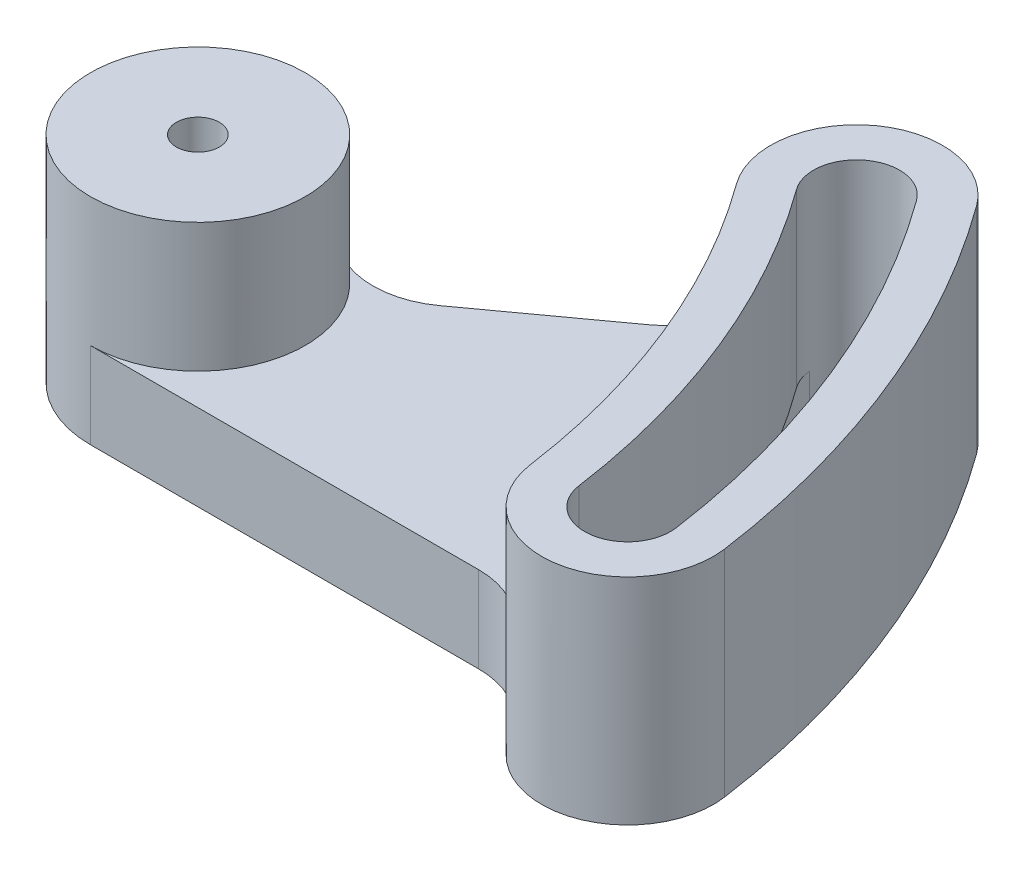
from build123d import *

# Parameters (mm, degrees)
SKETCH1_R                = 25
SKETCH1_R_2              = 5
BOSS_EXTRUDE1_DEPTH      = 50
BOSS_EXTRUDE4_DEPTH      = 20
BOSS_EXTRUDE5_DEPTH      = 30
BOSS_EXTRUDE5_DEPTH_BACK = 20
FILLET2_R                = 20
SHELL2_DEPTH             = 40
SHELL2_2_DEPTH           = 10
CUT_EXTRUDE2_DEPTH       = 171.486818667
CUT_EXTRUDE2_DEPTH_BACK  = 171.486818667


# Read off the part's stored shape, not the designer's step: Shell2
with BuildPart() as part:
    # Sketch1 → Boss-Extrude1 (new body)
    with BuildSketch(Plane(origin=(0, 0, 0), x_dir=(1, 0, 0), z_dir=(0, 1, 0))):
        with Locations(Location((0, 0, 0), (0, 0, 270))):
            Circle(SKETCH1_R)
        with Locations(Location((0, 0, 0), (0, 0, 270))):
            Circle(SKETCH1_R_2, mode=Mode.SUBTRACT)
    extrude(amount=BOSS_EXTRUDE1_DEPTH)

    # Sketch3 → Boss-Extrude4 (add)
    with BuildSketch(Plane(origin=(0, 0, 0), x_dir=(1, 0, 0), z_dir=(0, 1, 0))):
        with BuildLine():
            Line((0, -25), (125, -25))
            ThreePointArc((125, -25), (112.372583962, 21.969985307), (88.780749417, 64.502990119))
            Line((88.780749417, 64.502990119), (20.225424859, 14.694631307))
            ThreePointArc((20.225424859, 14.694631307), (23.776412907, 7.725424859), (25, 0))
            ThreePointArc((25, 0), (17.67766953, -17.67766953), (0, -25))
        make_face()
    extrude(amount=BOSS_EXTRUDE4_DEPTH)

    # Sketch4 → Boss-Extrude5 (add, two sides: drawn at the far end of the back side and taken through both)
    with BuildSketch(Plane(origin=(0, 20, 0), x_dir=(1, 0, 0), z_dir=(0, 1, 0)).offset(-BOSS_EXTRUDE5_DEPTH_BACK)):
        with BuildLine():
            ThreePointArc((144.802264946, -22.194593966), (130.912107304, 29.472389872), (104.961089304, 76.258695165))
            ThreePointArc((104.961089304, 76.258695165), (77.025044371, 80.683330007), (72.600409529, 52.747285074))
            ThreePointArc((72.600409529, 52.747285074), (93.83306062, 14.467580743), (105.197735054, -27.805406034))
            ThreePointArc((105.197735054, -27.805406034), (127.805406034, -44.802264946), (144.802264946, -22.194593966))
        make_face()
    extrude(amount=BOSS_EXTRUDE5_DEPTH + BOSS_EXTRUDE5_DEPTH_BACK)

    # Fillet2
    # the kernel refuses this fillet: 20 mm, written as the material it adds along each edge
    with BuildSketch(Plane(origin=(20.225424859, 0, -14.694631307), x_dir=(-0.7569254846609251, 0, -0.6535011940852316), z_dir=(0, 1, 0))) as fillet2_piece_1:
        with BuildLine():
            CenterArc((15.977305143, -19.472064177), FILLET2_R, 103.193899981, 63.612200039)
            Line((-3.494759034, -14.90711985), (0, 0))
            ThreePointArc((0, 0), (5.706180408, -0.659919779), (11.412360816, 0))
        make_face()
    extrude(amount=20)
    with BuildSketch(Plane(origin=(104.777715273, 20, 25), x_dir=(-1, 0, 0), z_dir=(0, -1, 0))) as fillet2_piece_2:
        with BuildLine():
            CenterArc((14.418731424, -20), FILLET2_R, 90, 60)
            Line((-2.901776652, -10), (-4.633827459, -9))
            ThreePointArc((-4.633827459, -9), (-2.400246276, -2.524865431), (-1.975559608, 0.311711782))
            Line((-1.975559608, 0.311711782), (0, 2))
            Line((0, 2), (14.418731424, 2))
            Line((14.418731424, 2), (14.418731424, 0))
        make_face()
    extrude(amount=20)
    with BuildSketch(Plane(origin=(72.600409529, 0, -52.747285074), x_dir=(-0.8090169943749511, 0, 0.5877852522924683), z_dir=(0, 1, 0))) as fillet2_piece_3:
        with BuildLine():
            CenterArc((14.641016151, -20), FILLET2_R, 90, 60)
            ThreePointArc((-2.679491924, -10), (-0.681483474, -5.176380902), (0, 0))
            Line((0, 0), (14.641016151, 0))
        make_face()
    extrude(amount=20)

    # Shell2 outline → Shell2 (cut)
    with BuildSketch(Plane(origin=(0, 0, 0), x_dir=(1, 0, 0), z_dir=(0, 1, 0))):
        with BuildLine():
            ThreePointArc((115.098867527, -26.402703017), (126.402703017, -34.901132473), (134.901132473, -23.597296983))
            ThreePointArc((134.901132473, -23.597296983), (121.642345633, 25.721187589), (96.87091936, 70.380842642))
            ThreePointArc((96.87091936, 70.380842642), (82.902896893, 72.593160063), (80.690579473, 58.625137596))
            ThreePointArc((80.690579473, 58.625137596), (103.102822291, 18.218783025), (115.098867527, -26.402703017))
        make_face()
    extrude(amount=SHELL2_DEPTH, mode=Mode.SUBTRACT)

    # Shell2 2 outline → Shell2 2 (cut)
    with BuildSketch(Plane(origin=(0, 0, 0), x_dir=(1, 0, 0), z_dir=(0, 1, 0))):
        with BuildLine():
            ThreePointArc((6.95227087, 13.291573637), (14.566633183, -3.579552727), (0, -15))
            Line((0, -15), (90.358983849, -15))
            ThreePointArc((90.358983849, -15), (105.358983849, -19.019237886), (116.339745962, -30))
            ThreePointArc((116.339745962, -30), (115.546619457, -28.260919549), (115.098867527, -26.402703017))
            ThreePointArc((115.098867527, -26.402703017), (103.102822291, 18.218783025), (80.690579473, 58.625137596))
            ThreePointArc((80.690579473, 58.625137596), (79.444945152, 60.919310624), (78.835530463, 63.457705487))
            ThreePointArc((78.835530463, 63.457705487), (76.406237331, 48.119752296), (66.633431171, 36.051341757))
            Line((66.633431171, 36.051341757), (38.49037018, 15.604211079))
            ThreePointArc((38.49037018, 15.604211079), (23.050773127, 9.955052843), (6.95227087, 13.291573637))
        make_face()
    extrude(amount=SHELL2_2_DEPTH, mode=Mode.SUBTRACT)

    # Sketch4<3> → Cut-Extrude2 (cut, two sides: drawn at the far end of the back side and taken through both)
    with BuildSketch(Plane(origin=(0, 20, 0), x_dir=(1, 0, 0), z_dir=(0, 1, 0)).offset(-CUT_EXTRUDE2_DEPTH_BACK)):
        with BuildLine():
            Line((125, -25), (114.894805022, -25))
            ThreePointArc((114.894805022, -25), (114.998144363, -25.70116121), (115.098867527, -26.402703017))
            ThreePointArc((115.098867527, -26.402703017), (126.402703017, -34.901132473), (134.901132473, -23.597296983))
            ThreePointArc((134.901132473, -23.597296983), (121.642345633, 25.721187589), (96.87091936, 70.380842642))
            ThreePointArc((96.87091936, 70.380842642), (82.902896894, 72.593160063), (80.690579473, 58.625137596))
            Line((80.690579473, 58.625137596), (88.780749417, 64.502990119))
            ThreePointArc((88.780749417, 64.502990119), (112.372583962, 21.969985307), (125, -25))
        make_face()
        with BuildLine():
            ThreePointArc((80.690579473, 58.625137596), (102.835736386, 18.875266979), (114.894805022, -25))
            Line((114.894805022, -25), (125, -25))
            ThreePointArc((125, -25), (112.372583962, 21.969985307), (88.780749417, 64.502990119))
            Line((88.780749417, 64.502990119), (80.690579473, 58.625137596))
        make_face()
    extrude(amount=CUT_EXTRUDE2_DEPTH + CUT_EXTRUDE2_DEPTH_BACK, mode=Mode.SUBTRACT)


solid = part.part
